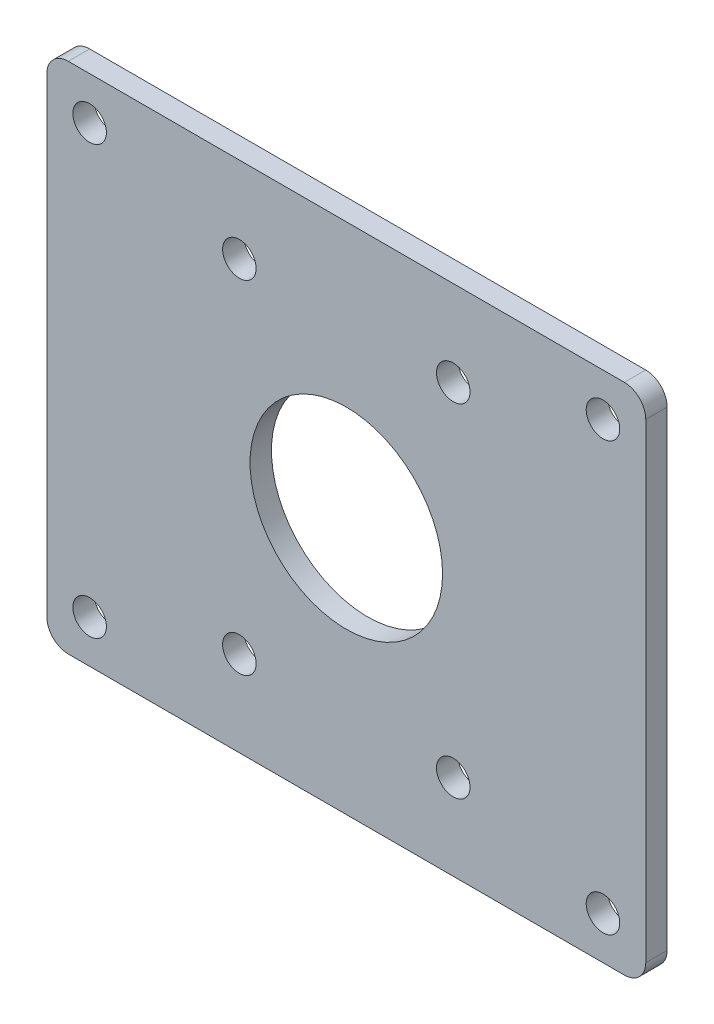
from build123d import *

# Parameters (mm, degrees)
SKETCH1_W           = 88.9
SKETCH1_H           = 76.2
SKETCH1_R           = 14.2875
SKETCH1_R_2         = 2.4892
BOSS_EXTRUDE1_DEPTH = 3.175
FILLET1_R           = 3.175


with BuildPart() as part:
    # Sketch1 → Boss-Extrude1 (new body)
    with BuildSketch(Plane.XY):
        Rectangle(SKETCH1_W, SKETCH1_H)
        Circle(SKETCH1_R, mode=Mode.SUBTRACT)
        with Locations((-15.875, -25.4)):
            Circle(SKETCH1_R_2, mode=Mode.SUBTRACT)
        with Locations((15.875, -25.4)):
            Circle(SKETCH1_R_2, mode=Mode.SUBTRACT)
        with Locations((15.875, 25.4)):
            Circle(SKETCH1_R_2, mode=Mode.SUBTRACT)
        with Locations((-15.875, 25.4)):
            Circle(SKETCH1_R_2, mode=Mode.SUBTRACT)
        with Locations((-38.1, 31.75)):
            Circle(SKETCH1_R_2, mode=Mode.SUBTRACT)
        with Locations((-38.1, -31.75)):
            Circle(SKETCH1_R_2, mode=Mode.SUBTRACT)
        with Locations((38.1, -31.75)):
            Circle(SKETCH1_R_2, mode=Mode.SUBTRACT)
        with Locations((38.1, 31.75)):
            Circle(SKETCH1_R_2, mode=Mode.SUBTRACT)
    extrude(amount=BOSS_EXTRUDE1_DEPTH)

    # Fillet1
    fillet1_edges = [part.edges().sort_by_distance(p)[0] for p in [
        (44.45, -38.1, 1.5875),
        (-44.45, -38.1, 1.5875),
        (-44.45, 38.1, 1.5875),
        (44.45, 38.1, 1.5875),
    ]]
    fillet(fillet1_edges, radius=FILLET1_R)


solid = part.part
